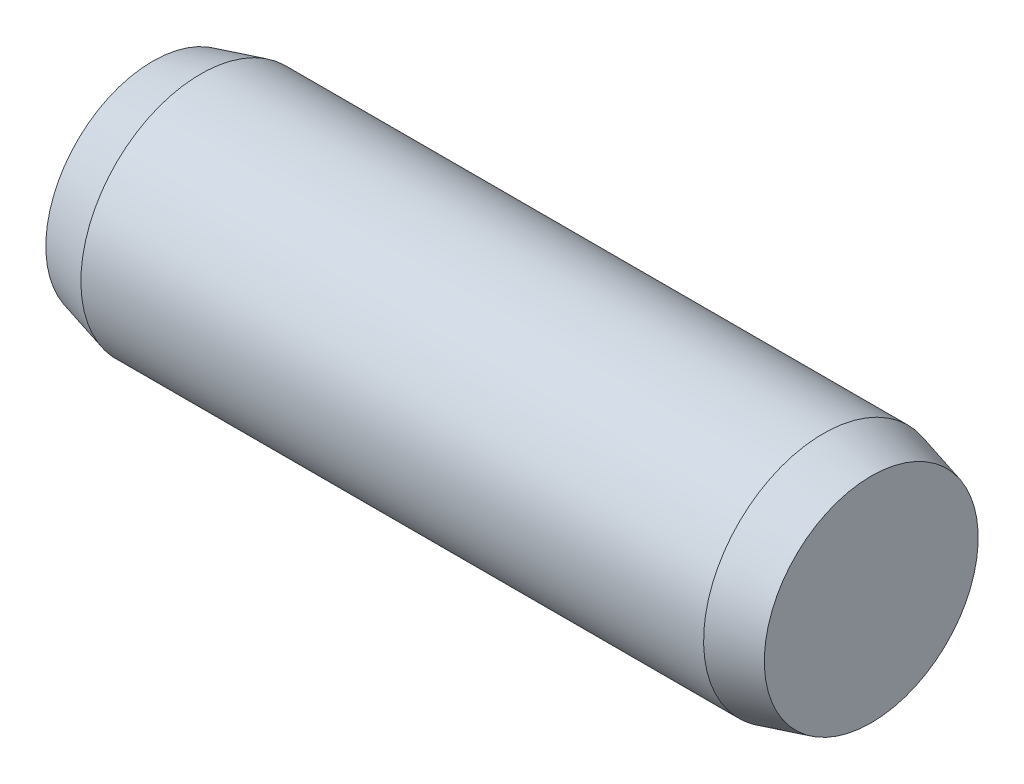
from build123d import *


with BuildPart() as part:
    # BodySke → Body (revolve)
    with BuildSketch(Plane.XY):
        Polygon((28, 5), (30, 4.464101615), (30, 0), (0, 0), (0, 4.464101615), (2, 5), align=None)
    revolve(axis=Axis((0, 0, 0), (1, 0, 0)))


solid = part.part
